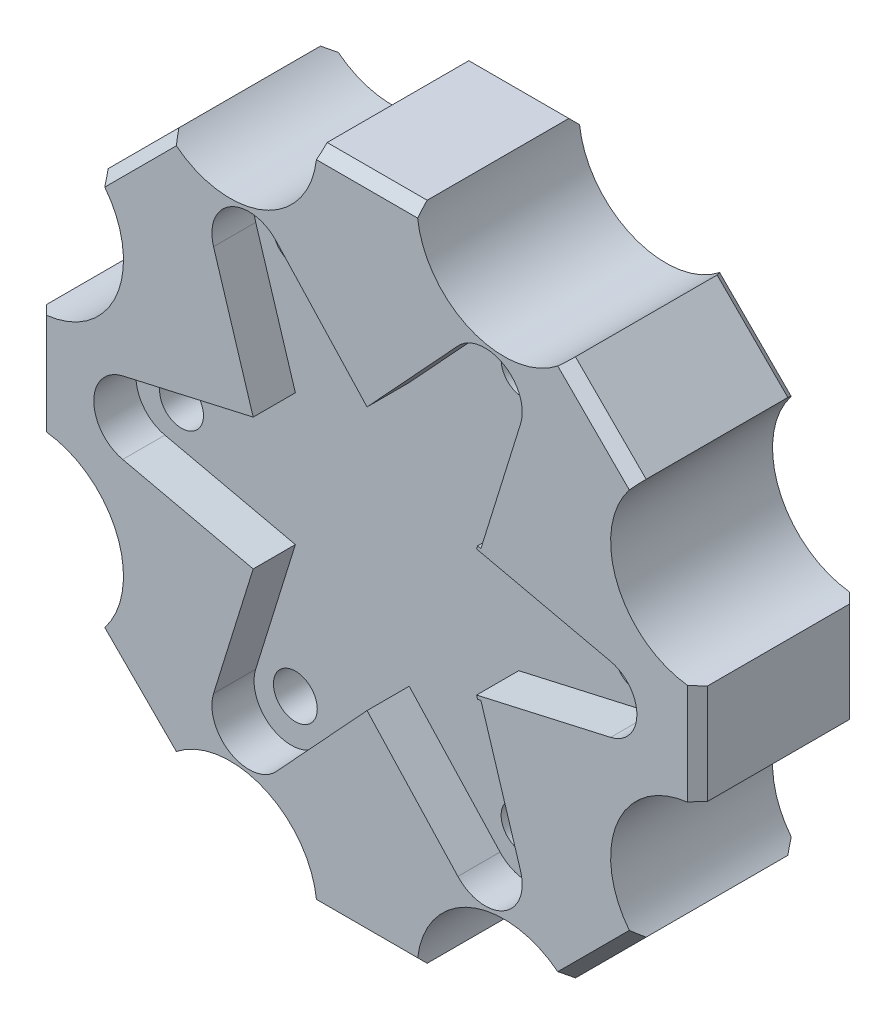
from build123d import *

# Parameters (mm, degrees)
BOSS_EXTRUDE1_DEPTH  = 9.6
CHAMFER2_SIZE        = 0.6
CUT_EXTRUDE2_DEPTH   = 2.5
M2_CLEARANCE_HOLE1_D = 2.6
CUT_EXTRUDE3_START   = -9.6
CUT_EXTRUDE3_DEPTH   = 5.5
CHAMFER3_SIZE        = 1.5


with BuildPart() as part:
    # Sketch1 → Boss-Extrude1 (new body)
    with BuildSketch(Plane.XY):
        with BuildLine():
            ThreePointArc((-11.756599923, -15.949743136), (-6.144180323, -14.833363466), (-2.965, -19.591343059))
            Line((-2.965, -19.591343059), (2.965, -19.591343059))
            ThreePointArc((2.965, -19.591343059), (6.144180323, -14.833363466), (11.756599923, -15.949743136))
            Line((11.756599923, -15.949743136), (15.949743136, -11.756599923))
            ThreePointArc((15.949743136, -11.756599923), (14.833363466, -6.144180323), (19.591343059, -2.965))
            Line((19.591343059, -2.965), (19.591343059, 2.965))
            ThreePointArc((19.591343059, 2.965), (14.833363466, 6.144180323), (15.949743136, 11.756599923))
            Line((15.949743136, 11.756599923), (11.756599923, 15.949743136))
            ThreePointArc((11.756599923, 15.949743136), (6.144180323, 14.833363466), (2.965, 19.591343059))
            Line((2.965, 19.591343059), (-2.965, 19.591343059))
            ThreePointArc((-2.965, 19.591343059), (-6.144180323, 14.833363466), (-11.756599923, 15.949743136))
            Line((-11.756599923, 15.949743136), (-15.949743136, 11.756599923))
            ThreePointArc((-15.949743136, 11.756599923), (-14.833363466, 6.144180323), (-19.591343059, 2.965))
            Line((-19.591343059, 2.965), (-19.591343059, -2.965))
            ThreePointArc((-19.591343059, -2.965), (-14.833363466, -6.144180323), (-15.949743136, -11.756599923))
            Line((-15.949743136, -11.756599923), (-11.756599923, -15.949743136))
        make_face()
    extrude(amount=BOSS_EXTRUDE1_DEPTH)

    # Chamfer2
    chamfer2_edges = [part.edges().sort_by_distance(p)[0] for p in [
        (-19.591343059, 0, 9.6),
        (-13.853171529, 13.853171529, 0),
        (0, 19.591343059, 0),
        (13.853171529, 13.853171529, 0),
        (19.591343059, 0, 0),
        (-13.853171529, -13.853171529, 9.6),
        (13.853171529, -13.853171529, 0),
        (0, -19.591343059, 0),
        (-13.853171529, -13.853171529, 0),
        (-19.591343059, 0, 0),
        (0, -19.591343059, 9.6),
        (13.853171529, -13.853171529, 9.6),
        (19.591343059, 0, 9.6),
        (13.853171529, 13.853171529, 9.6),
        (0, 19.591343059, 9.6),
        (-13.853171529, 13.853171529, 9.6),
    ]]
    chamfer(chamfer2_edges, length=CHAMFER2_SIZE)

    # Sketch4 → Cut-Extrude2 (cut)
    with BuildSketch(Plane.XY.offset(9.6)):
        with BuildLine():
            ThreePointArc((14.441692106, -1.95061736), (16, 0), (14.441692106, 1.95061736))
            Line((14.441692106, 1.95061736), (6.69085075, 3.70569527))
            Line((6.69085075, 3.70569527), (6.495190528, 3.75))
            Line((6.495190528, 3.75), (6.554651618, 3.941599088))
            Line((6.554651618, 3.941599088), (6.750311839, 3.897294358))
            Line((6.750311839, 3.897294358), (9.101143263, 11.472284348))
            ThreePointArc((9.101143263, 11.472284348), (8.1, 14.029611541), (5.384718053, 13.617963443))
            Line((5.384718053, 13.617963443), (0, 7.794588715))
            Line((0, 7.794588715), (-5.384718053, 13.617963443))
            ThreePointArc((-5.384718053, 13.617963443), (-8.1, 14.029611541), (-9.101143263, 11.472284348))
            Line((-9.101143263, 11.472284348), (-6.750311839, 3.897294358))
            Line((-6.750311839, 3.897294358), (-14.485861316, 2.145679096))
            ThreePointArc((-14.485861316, 2.145679096), (-16.2, 0), (-14.485861316, -2.145679096))
            Line((-14.485861316, -2.145679096), (-6.750311839, -3.897294358))
            Line((-6.750311839, -3.897294358), (-9.101143263, -11.472284348))
            ThreePointArc((-9.101143263, -11.472284348), (-8.1, -14.029611541), (-5.384718053, -13.617963443))
            Line((-5.384718053, -13.617963443), (0, -7.794588715))
            Line((0, -7.794588715), (5.384718053, -13.617963443))
            ThreePointArc((5.384718053, -13.617963443), (8.1, -14.029611541), (9.101143263, -11.472284348))
            Line((9.101143263, -11.472284348), (6.750311839, -3.897294358))
            Line((6.750311839, -3.897294358), (6.554651618, -3.941599088))
            Line((6.554651618, -3.941599088), (6.495190528, -3.75))
            Line((6.495190528, -3.75), (6.69085075, -3.70569527))
            Line((6.69085075, -3.70569527), (14.441692106, -1.95061736))
        make_face()
    extrude(amount=-CUT_EXTRUDE2_DEPTH, mode=Mode.SUBTRACT)

    # M2 Clearance Hole1 (through all)
    with Locations(Plane.XY.offset(7.1)):
        with Locations((13.5, 0), (6.75, -11.691342951), (-6.75, -11.691342951), (-13.5, 0), (-6.75, 11.691342951), (6.75, 11.691342951)):
            Hole(M2_CLEARANCE_HOLE1_D / 2)

    # Sketch3<2> → Cut-Extrude3 (cut)
    with BuildSketch(Plane.XY.offset(9.6).offset(CUT_EXTRUDE3_START)):
        with BuildLine():
            Line((-2, -1.5), (-5.5, -1.5))
            Line((-5.5, -1.5), (-5.5, 1.5))
            Line((-5.5, 1.5), (-2, 1.5))
            ThreePointArc((-2, 1.5), (0, 2.5), (2, 1.5))
            Line((2, 1.5), (5.5, 1.5))
            Line((5.5, 1.5), (5.5, -1.5))
            Line((5.5, -1.5), (2, -1.5))
            ThreePointArc((2, -1.5), (0, -2.5), (-2, -1.5))
        make_face()
    extrude(amount=CUT_EXTRUDE3_DEPTH, mode=Mode.SUBTRACT)

    # Chamfer3
    chamfer3_edges = [part.edges().sort_by_distance(p)[0] for p in [
        (-3.75, -1.5, 5.5),
        (0, -2.5, 5.5),
        (3.75, -1.5, 5.5),
        (5.5, 0, 5.5),
        (3.75, 1.5, 5.5),
        (0, 2.5, 5.5),
        (-3.75, 1.5, 5.5),
        (-5.5, 0, 5.5),
    ]]
    chamfer(chamfer3_edges, length=CHAMFER3_SIZE - 0.0001)  # a hair under: the kernel refuses the full size


solid = part.part
